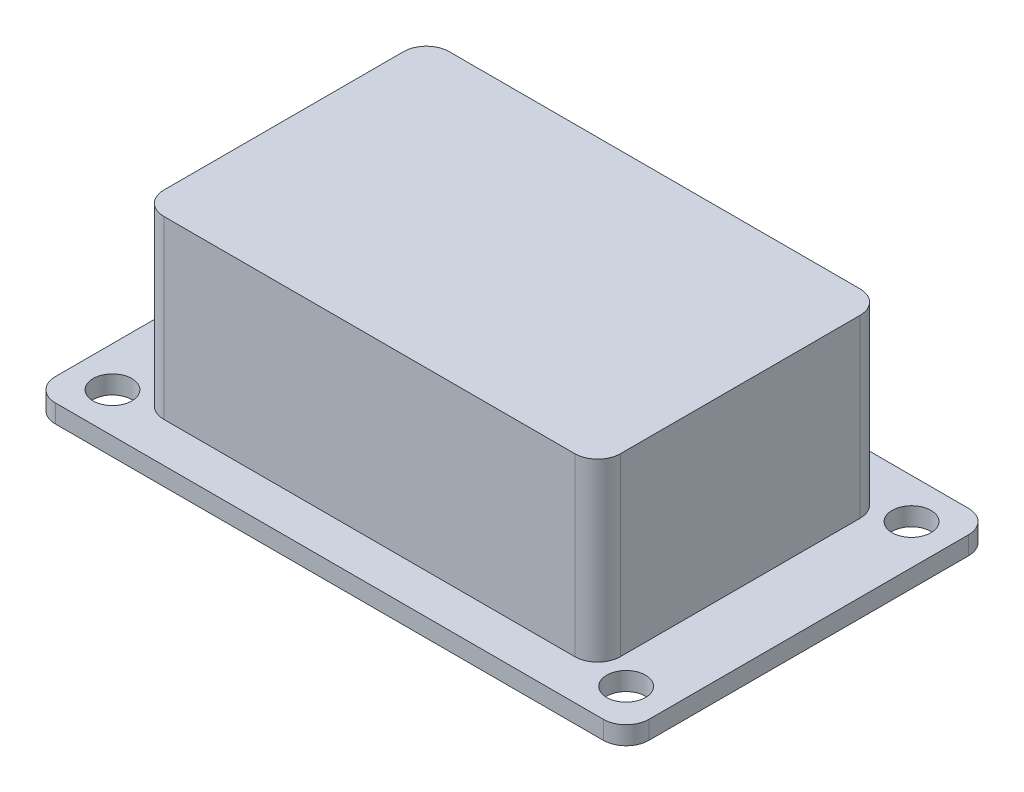
from build123d import *

# Parameters (mm, degrees)
BOSS_EXTRUDE1_DEPTH = 1.6
BOSS_EXTRUDE2_DEPTH = 15.4
SKETCH3_R           = 1.7
CUT_EXTRUDE1_DEPTH  = 1.6


with BuildPart() as part:
    # Sketch1 → Boss-Extrude1 (new body)
    with BuildSketch(Plane(origin=(0, 0, 0), x_dir=(1, 0, 0), z_dir=(0, 1, 0))):
        with BuildLine():
            Line((-24, -16), (24, -16))
            ThreePointArc((24, -16), (25.414213562, -15.414213562), (26, -14))
            Line((26, -14), (26, 14))
            ThreePointArc((26, 14), (25.414213562, 15.414213562), (24, 16))
            Line((24, 16), (-24, 16))
            ThreePointArc((-24, 16), (-25.414213562, 15.414213562), (-26, 14))
            Line((-26, 14), (-26, -14))
            ThreePointArc((-26, -14), (-25.414213562, -15.414213562), (-24, -16))
        make_face()
    extrude(amount=BOSS_EXTRUDE1_DEPTH)

    # Sketch2 → Boss-Extrude2 (add)
    with BuildSketch(Plane(origin=(0, 1.6, 0), x_dir=(1, 0, 0), z_dir=(0, 1, 0))):
        with BuildLine():
            Line((-18, -12.5), (18, -12.5))
            ThreePointArc((18, -12.5), (19.414213562, -11.914213562), (20, -10.5))
            Line((20, -10.5), (20, 10.5))
            ThreePointArc((20, 10.5), (19.414213562, 11.914213562), (18, 12.5))
            Line((18, 12.5), (-18, 12.5))
            ThreePointArc((-18, 12.5), (-19.414213562, 11.914213562), (-20, 10.5))
            Line((-20, 10.5), (-20, -10.5))
            ThreePointArc((-20, -10.5), (-19.414213562, -11.914213562), (-18, -12.5))
        make_face()
    extrude(amount=BOSS_EXTRUDE2_DEPTH)

    # Sketch3 → Cut-Extrude1 (cut)
    with BuildSketch(Plane(origin=(0, 0, 0), x_dir=(1, 0, 0), z_dir=(0, 1, 0))):
        with Locations((22.5, -12.5)):
            Circle(SKETCH3_R)
        with Locations((22.5, 12.5)):
            Circle(SKETCH3_R)
        with Locations((-22.5, -12.5)):
            Circle(SKETCH3_R)
        with Locations((-22.5, 12.5)):
            Circle(SKETCH3_R)
    extrude(amount=CUT_EXTRUDE1_DEPTH, mode=Mode.SUBTRACT)


solid = part.part
